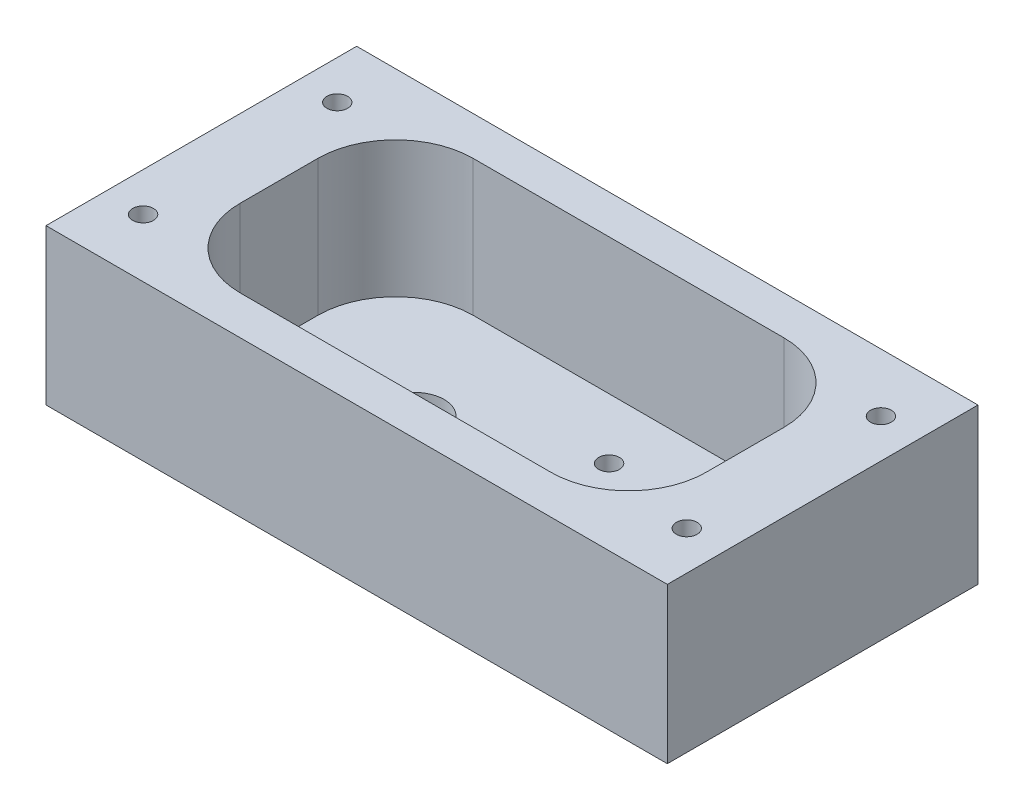
from build123d import *

# Parameters (mm, degrees)
SKETCH1_W            = 101.6
SKETCH1_H            = 50.8
BOSS_EXTRUDE1_DEPTH  = 25.4
SKETCH2_R            = 4.7625
SKETCH2_R_2          = 3
CUT_EXTRUDE1_DEPTH   = 63.217039467
CUT_EXTRUDE2_DEPTH   = 22.225
M3_CLEARANCE_HOLE1_D = 3.4


with BuildPart() as part:
    # Sketch1 → Boss-Extrude1 (new body)
    with BuildSketch(Plane(origin=(0, 0, 0), x_dir=(1, 0, 0), z_dir=(0, 1, 0))):
        Rectangle(SKETCH1_W, SKETCH1_H)
    extrude(amount=BOSS_EXTRUDE1_DEPTH)

    # Sketch2 → Cut-Extrude1 (cut, through all)
    with BuildSketch(Plane.XZ):
        with Locations((-15.875, 0)):
            Circle(SKETCH2_R)
        with Locations((15.875, 0)):
            Circle(SKETCH2_R_2)
    extrude(amount=-CUT_EXTRUDE1_DEPTH, mode=Mode.SUBTRACT)

    # Sketch3 → Cut-Extrude2 (cut)
    with BuildSketch(Plane(origin=(0, 25.4, 0), x_dir=(1, 0, 0), z_dir=(0, 1, 0))):
        with BuildLine():
            Line((-25.4, -19.05), (25.4, -19.05))
            ThreePointArc((25.4, -19.05), (34.380256121, -15.330256121), (38.1, -6.35))
            Line((38.1, -6.35), (38.1, 6.35))
            ThreePointArc((38.1, 6.35), (34.380256121, 15.330256121), (25.4, 19.05))
            Line((25.4, 19.05), (-25.4, 19.05))
            ThreePointArc((-25.4, 19.05), (-34.380256121, 15.330256121), (-38.1, 6.35))
            Line((-38.1, 6.35), (-38.1, -6.35))
            ThreePointArc((-38.1, -6.35), (-34.380256121, -15.330256121), (-25.4, -19.05))
        make_face()
    extrude(amount=-CUT_EXTRUDE2_DEPTH, mode=Mode.SUBTRACT)

    # M3 Clearance Hole1 (through all)
    with Locations(Plane(origin=(-44.45, 0, 15.875), x_dir=(0, 0, -1), z_dir=(0, -1, 0))):
        with Locations((0, 0), (31.75, 0), (6.682611845, 51.132611845), (25.067388155, 51.132611845), (6.682611845, 69.517388155), (25.067388155, 69.517388155), (0, 88.9), (31.75, 88.9)):
            Hole(M3_CLEARANCE_HOLE1_D / 2)


solid = part.part
